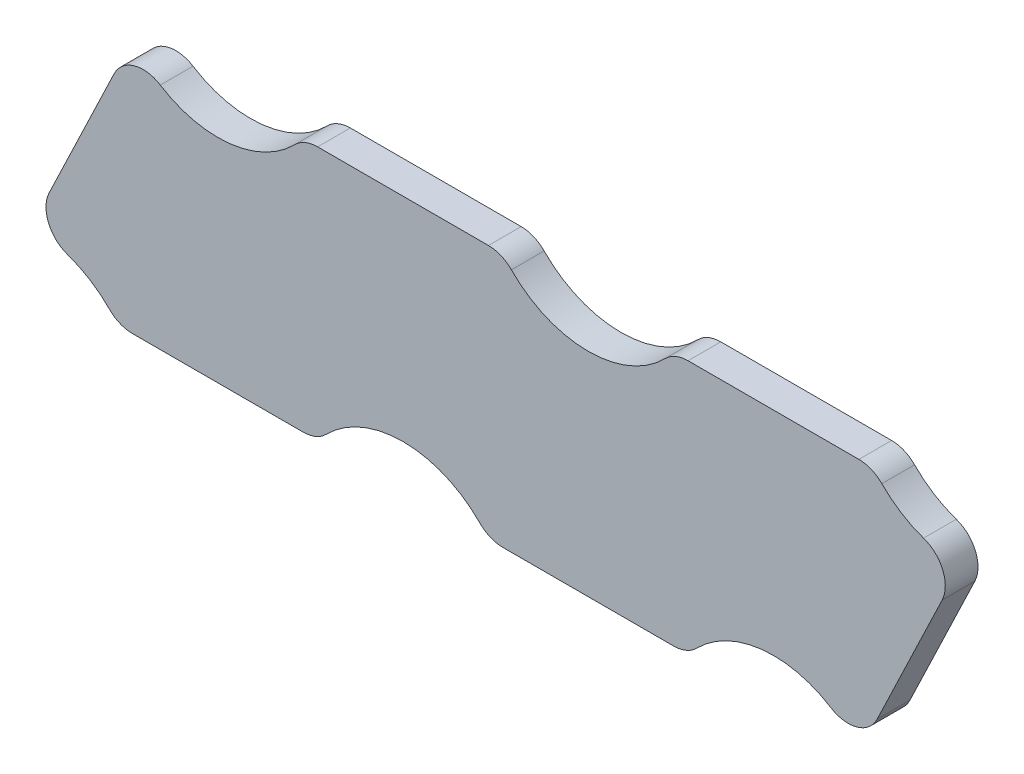
from build123d import *

# Parameters (mm, degrees)
BOSS_EXTRUDE1_DEPTH = 2.032
FILLET1_R           = 2


with BuildPart() as part:
    # Sketch3 → Boss-Extrude1 (new body)
    with BuildSketch(Plane.XY):
        with BuildLine():
            ThreePointArc((10.658308864, 17.473983742), (13.670205209, 16.817167392), (16.069205037, 14.88126266))
            Line((16.069205037, 14.88126266), (28.480794963, 14.88126266))
            ThreePointArc((28.480794963, 14.88126266), (33.775, 17.475), (39.069205037, 14.88126266))
            Line((39.069205037, 14.88126266), (51.480794963, 14.88126266))
            ThreePointArc((51.480794963, 14.88126266), (56.775, 17.475), (62.069205037, 14.88126266))
            Line((62.069205037, 14.88126266), (68.391691136, 28.076016258))
            ThreePointArc((68.391691136, 28.076016258), (65.379794791, 28.732832608), (62.980794963, 30.66873734))
            Line((62.980794963, 30.66873734), (50.569205037, 30.66873734))
            ThreePointArc((50.569205037, 30.66873734), (45.275, 28.075), (39.980794963, 30.66873734))
            Line((39.980794963, 30.66873734), (27.569205037, 30.66873734))
            ThreePointArc((27.569205037, 30.66873734), (22.275, 28.075), (16.980794963, 30.66873734))
            Line((16.980794963, 30.66873734), (10.658308864, 17.473983742))
        make_face()
    extrude(amount=BOSS_EXTRUDE1_DEPTH)

    # Fillet1
    fillet1_edges = [part.edges().sort_by_distance(p)[0] for p in [
        (62.980794963, 30.66873734, 1.016),
        (50.569205037, 30.66873734, 1.016),
        (39.980794963, 30.66873734, 1.016),
        (27.569205037, 30.66873734, 1.016),
        (16.069205037, 14.88126266, 1.016),
        (28.480794963, 14.88126266, 1.016),
        (39.069205037, 14.88126266, 1.016),
        (51.480794963, 14.88126266, 1.016),
        (68.391691136, 28.076016258, 1.016),
        (62.069205037, 14.88126266, 1.016),
        (10.658308864, 17.473983742, 1.016),
        (16.980794963, 30.66873734, 1.016),
    ]]
    fillet(fillet1_edges, radius=FILLET1_R)


solid = part.part
